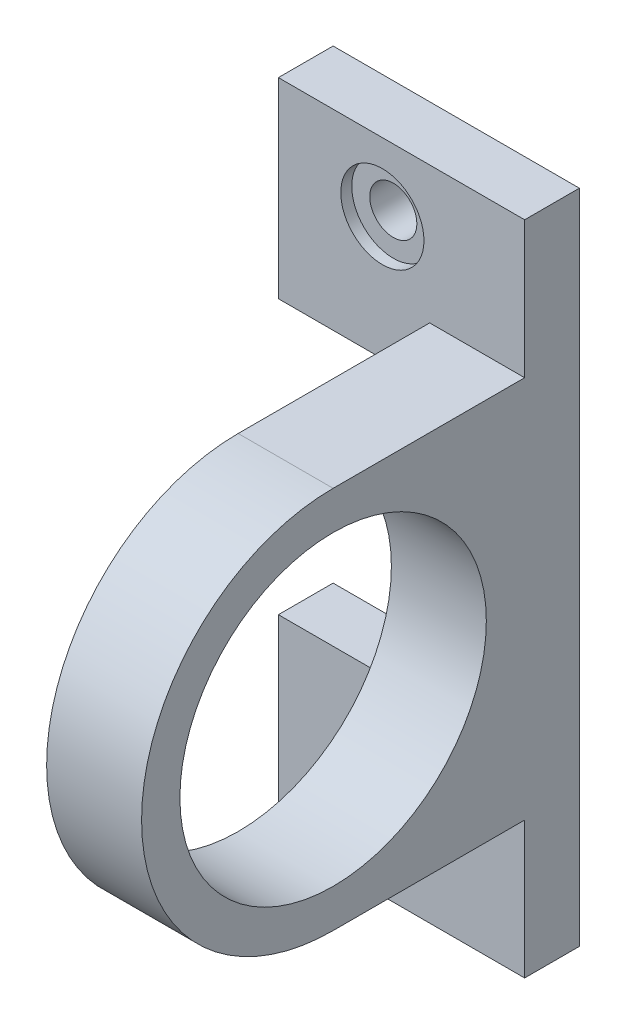
from build123d import *

# Parameters (mm, degrees)
SKETCH_2_W                     = 45
SKETCH_2_H                     = 60
SKETCH_2_W_2                   = 27.647058823
SKETCH_2_H_2                   = 25
EXTRUDE_2_DEPTH                = 5
SKETCH_4_W                     = 8.676470589
SKETCH_4_H                     = 35
SKETCH_4_W_2                   = 8.676470588
EXTRUDE_15_DEPTH               = 35
CUT_EXTRUDE_1_DEPTH            = 45
SKETCH_6_R                     = 14
CUT_EXTRUDE_2_DEPTH            = 45
FILLET_1_R                     = 5
SKETCH_7_R                     = 15
SKETCH_7_R_2                   = 13
EXTRUDE_16_DEPTH               = 1
SPLIT_BODIES_1_SURFACE_1_BACK  = 86
SPLIT_BODIES_1_SURFACE_1_DEPTH = 172
SPLIT_BODIES_1_SURFACE_2_BACK  = 86
SPLIT_BODIES_1_SURFACE_2_DEPTH = 172
HOLE_WIZARD_1_D                = 4.3
HOLE_WIZARD_1_DEPTH            = 5
HOLE_WIZARD_1_CBORE_D          = 7.6
HOLE_WIZARD_1_CBORE_DEPTH      = 1
HOLE_WIZARD_1_TIP              = 1.291850331


with BuildPart() as part:
    # 草图2 → 凸台-拉伸2 (new body)
    with BuildSketch(Plane.XY):
        with Locations((7.726423565, -5.661764706)):
            Rectangle(SKETCH_2_W, SKETCH_2_H)
        with Locations((7.726423565, -5.661764706)):
            Rectangle(SKETCH_2_W_2, SKETCH_2_H_2, mode=Mode.SUBTRACT)
    extrude(amount=EXTRUDE_2_DEPTH)

    # 草图4 → 凸台-拉伸15 (add)
    with BuildSketch(Plane.XY.offset(5)):
        with Locations((-10.435341141, -5.661764706)):
            Rectangle(SKETCH_4_W, SKETCH_4_H)
        with Locations((25.888188271, -5.661764706)):
            Rectangle(SKETCH_4_W_2, SKETCH_4_H)
    extrude(amount=EXTRUDE_15_DEPTH)

    # 草图5 → 切除-拉伸1 (cut)
    with BuildSketch(Plane.ZY.offset(14.773576435)):
        with BuildLine():
            ThreePointArc((22.5, 11.838235294), (34.874368671, 6.712603965), (40, -5.661764706))
            Line((40, -5.661764706), (40, 11.838235294))
            Line((40, 11.838235294), (22.5, 11.838235294))
        make_face()
        with BuildLine():
            Line((40, -23.161764706), (40, -5.661764706))
            ThreePointArc((40, -5.661764706), (34.874368671, -18.036133377), (22.5, -23.161764706))
            Line((22.5, -23.161764706), (40, -23.161764706))
        make_face()
    extrude(amount=-CUT_EXTRUDE_1_DEPTH, mode=Mode.SUBTRACT)

    # 草图6 → 切除-拉伸2 (cut)
    with BuildSketch(Plane.ZY.offset(14.773576435)):
        with Locations((22.5, -5.661764706)):
            Circle(SKETCH_6_R)
    extrude(amount=-CUT_EXTRUDE_2_DEPTH, mode=Mode.SUBTRACT)

    # 圆角1
    fillet_1_edges = [part.edges().sort_by_distance(p)[0] for p in [
        (-6.097105846, 6.838235294, 2.5),
        (21.549952977, 6.838235294, 2.5),
        (-6.097105846, -18.161764706, 2.5),
        (21.549952977, -18.161764706, 2.5),
    ]]
    fillet(fillet_1_edges, radius=FILLET_1_R)

    # 草图7 → 凸台-拉伸16 (add)
    with BuildSketch(Plane(origin=(-6.097105846, 0, 0), x_dir=(0, 0, -1), z_dir=(1, 0, 0))):
        with Locations((-22.5, -5.661764706)):
            Circle(SKETCH_7_R)
        with Locations((-22.5, -5.661764706)):
            Circle(SKETCH_7_R_2, mode=Mode.SUBTRACT)
    extrude(amount=-EXTRUDE_16_DEPTH)


with BuildPart() as body_2:
    # Split Bodies 1: the piece behind the surface
    add(part.part)
    # Split Bodies 1 surface: a surface, the sketch's curves swept straight by 172 mm
    with BuildLine(Plane.XY.offset(5).offset(-SPLIT_BODIES_1_SURFACE_1_BACK), mode=Mode.PRIVATE) as split_bodies_1_surface_1_path:
        Line((7.726423565, 24.338235294), (7.726423565, -35.661764706))
    split_bodies_1_surface_1 = Shell.extrude(split_bodies_1_surface_1_path.wire(), (0 * SPLIT_BODIES_1_SURFACE_1_DEPTH, 0 * SPLIT_BODIES_1_SURFACE_1_DEPTH, 1 * SPLIT_BODIES_1_SURFACE_1_DEPTH))
    split(bisect_by=split_bodies_1_surface_1, keep=Keep.BOTTOM)


with BuildPart() as part_1:
    add(part.part)

    # Split Bodies 1: split by a surface, the side it looks to stays
    # Split Bodies 1 surface: a surface, the sketch's curves swept straight by 172 mm
    with BuildLine(Plane.XY.offset(5).offset(-SPLIT_BODIES_1_SURFACE_2_BACK), mode=Mode.PRIVATE) as split_bodies_1_surface_2_path:
        Line((7.726423565, 24.338235294), (7.726423565, -35.661764706))
    split_bodies_1_surface_2 = Shell.extrude(split_bodies_1_surface_2_path.wire(), (0 * SPLIT_BODIES_1_SURFACE_2_DEPTH, 0 * SPLIT_BODIES_1_SURFACE_2_DEPTH, 1 * SPLIT_BODIES_1_SURFACE_2_DEPTH))
    split(bisect_by=split_bodies_1_surface_2, keep=Keep.TOP)

    # 打孔尺寸(%根据六角头螺)栓 全螺纹的类型1
    with Locations(Plane(origin=(17.226423565, 18.088235294, 5), x_dir=(1, 0, 0), z_dir=(0, 0, 1))):
        with Locations((0, 0), (0, -47.5)):
            CounterBoreHole(HOLE_WIZARD_1_D / 2, HOLE_WIZARD_1_CBORE_D / 2, HOLE_WIZARD_1_CBORE_DEPTH, depth=HOLE_WIZARD_1_DEPTH)
            with Locations((0, 0, -(HOLE_WIZARD_1_DEPTH + HOLE_WIZARD_1_TIP / 2))):  # 118° drill point
                Cone(0, HOLE_WIZARD_1_D / 2, HOLE_WIZARD_1_TIP, mode=Mode.SUBTRACT)


solid = part_1.part
